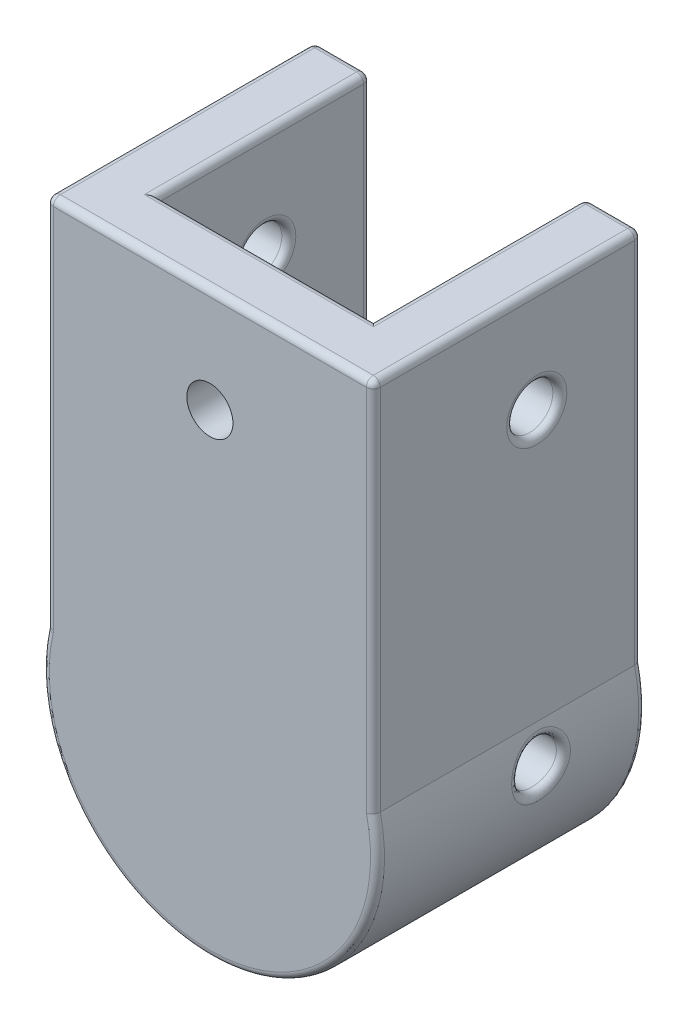
from build123d import *

# Parameters (mm, degrees)
SKETCH2_R                       = 12
BOSS_EXTRUDE1_DEPTH             = 15
BOSS_EXTRUDE2_START             = 4.2
SKETCH2_2_R                     = 12
BOSS_EXTRUDE2_DEPTH             = 4.2
BOSS_EXTRUDE3_REACH             = 34.726
BOSS_EXTRUDE3_END_RADIUS        = 12
BOSS_EXTRUDE3_DIRECTION_2_DEPTH = 15
SKETCH6_R                       = 1.65
CUT_EXTRUDE1_DEPTH              = 36.199293547
CIRPATTERN1_COUNT               = 2
CIRPATTERN1_ANGLE               = 90
SKETCH7_R                       = 1.6
CUT_EXTRUDE2_DEPTH              = 36.199293547
FILLET1_R                       = 0.5


with BuildPart() as part:
    # Sketch2 → Boss-Extrude1 (new body)
    with BuildSketch(Plane.XY):
        Circle(SKETCH2_R)
        with BuildLine():
            Line((2.35, -0.98795175), (2.35, -0.640312424))
            Line((2.35, -0.640312424), (2.35, 0.640312424))
            Line((2.35, 0.640312424), (2.35, 0.98795175))
            ThreePointArc((2.35, 0.98795175), (2.399306091, 1.204458101), (2.5375, 1.378264125))
            ThreePointArc((2.5375, 1.378264125), (2.631466171, 1.716262892), (2.340534209, 1.912302177))
            ThreePointArc((2.340534209, 1.912302177), (2.14501974, 1.945476116), (1.977779101, 2.052045279))
            ThreePointArc((1.977779101, 2.052045279), (-2.85, 0), (1.977779101, -2.052045279))
            ThreePointArc((1.977779101, -2.052045279), (2.14501974, -1.945476116), (2.340534209, -1.912302177))
            ThreePointArc((2.340534209, -1.912302177), (2.631466171, -1.716262892), (2.5375, -1.378264125))
            ThreePointArc((2.5375, -1.378264125), (2.399306091, -1.204458101), (2.35, -0.98795175))
        make_face(mode=Mode.SUBTRACT)
    extrude(amount=-BOSS_EXTRUDE1_DEPTH)

    # Sketch2<2> → Boss-Extrude2 (add)
    with BuildSketch(Plane.XY.offset(BOSS_EXTRUDE2_START)):
        Circle(SKETCH2_2_R)
    extrude(amount=-BOSS_EXTRUDE2_DEPTH)

    # Boss-Extrude3: up to this cylinder (the profile starts outside it)
    boss_extrude3_end = Plane(origin=(0, 0, -7.4), z_dir=(0, 0, 1)) * Cylinder(BOSS_EXTRUDE3_END_RADIUS, 94.452, mode=Mode.PRIVATE)
    # Sketch4 → Boss-Extrude3 (add, up to the surface)
    with BuildSketch(Plane.XZ.offset(-14.495597404), mode=Mode.PRIVATE) as boss_extrude3_sk1:
        Polygon((-7.7, -15), (-7.7, 0.2), (-0.00048092, 0.2), (7.7, 0.2), (7.7, -15), (11.7, -15), (11.7, 4.2), (-11.7, 4.2), (-11.7, -15), align=None)
    boss_extrude3_tool1 = extrude(boss_extrude3_sk1.sketch, amount=BOSS_EXTRUDE3_REACH, mode=Mode.PRIVATE) - boss_extrude3_end
    add(boss_extrude3_tool1.solids().sort_by_distance((-8.002688, 14.495597, -7.4))[0])

    # Sketch4 → Boss-Extrude3 direction 2 (add)
    with BuildSketch(Plane.XZ.offset(-14.495597404)):
        Polygon((-7.7, -15), (-7.7, 0.2), (-0.00048092, 0.2), (7.7, 0.2), (7.7, -15), (11.7, -15), (11.7, 4.2), (-11.7, 4.2), (-11.7, -15), align=None)
    extrude(amount=-BOSS_EXTRUDE3_DIRECTION_2_DEPTH)

    # Sketch6 → Cut-Extrude1 (cut, symmetric)
    with BuildSketch(Plane.XY):
        with Locations((0, 21.995597404)):
            Circle(SKETCH6_R)
    cut_extrude1 = extrude(amount=CUT_EXTRUDE1_DEPTH, both=True, mode=Mode.SUBTRACT)

    # CirPattern1: Cut-Extrude1 ×2 about axis
    cirpattern1_axis = Axis((0, 31.570377275, -7.5), (0, -1, 0))
    for i in range(1, CIRPATTERN1_COUNT):
        add(cut_extrude1.rotate(cirpattern1_axis, i * CIRPATTERN1_ANGLE / (CIRPATTERN1_COUNT - 1)), mode=Mode.SUBTRACT)

    # Sketch7 → Cut-Extrude2 (cut, through all)
    with BuildSketch(Plane(origin=(0, 0, 0), x_dir=(0, 0, -1), z_dir=(1, 0, 0))):
        with Locations((7.503688218, 0)):
            Circle(SKETCH7_R)
    extrude(amount=CUT_EXTRUDE2_DEPTH, mode=Mode.SUBTRACT)

    # Fillet1
    fillet1_edges = [part.edges().sort_by_distance(p)[0] for p in [
        (11.7, 16.081027865, 4.2),
        (0, -12, 4.2),
        (-11.7, 16.081027865, 4.2),
        (-7.7, 29.495597404, -7.4),
        (0, 29.495597404, 0.2),
        (7.7, 29.495597404, -7.4),
        (11.7, 29.495597404, -5.4),
        (0, 29.495597404, 4.2),
        (-11.7, 29.495597404, -5.4),
        (-7.7, 19.349700483, -15),
        (-9.7, 29.495597404, -15),
        (-11.7, 16.081027865, -15),
        (0, -12, -15),
        (11.7, 16.081027865, -15),
        (9.7, 29.495597404, -15),
        (7.7, 19.349700483, -15),
        (0, 12, -15),
        (2.399306091, 1.204458101, -15),
        (2.35, 0, -15),
        (2.399306091, -1.204458101, -15),
        (2.631466171, -1.716262892, -15),
        (2.14501974, -1.945476116, -15),
        (-2.85, 0, -15),
        (2.14501974, 1.945476116, -15),
        (2.631466171, 1.716262892, -15),
        (7.7, 21.995597404, -9.15),
        (-7.7, 21.995597404, -9.15),
        (12, 0, -5.903688218),
        (11.7, 21.995597404, -9.15),
        (-11.7, 21.995597404, -9.15),
        (-11.7, 2.666458325, -5.4),
    ]]
    fillet(fillet1_edges, radius=FILLET1_R)


solid = part.part
